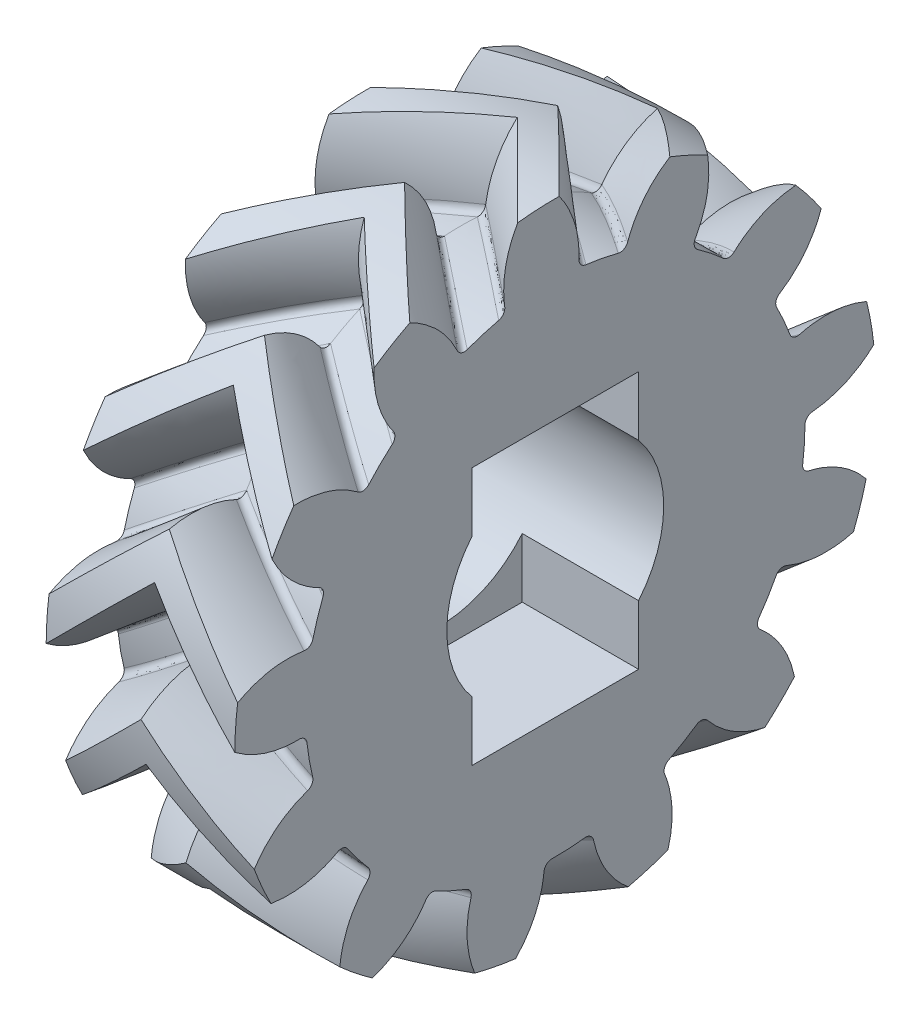
from build123d import *

# Parameters (mm, degrees)
BASPROSKE_W            = 3
BASPROSKE_H            = 10.192388155
TOOTHCUTRH_PITCH       = 64.040663503
TOOTHCUTRH_HEIGHT      = 3
TOOTHCUTRH_RADIUS      = 10.192388155
TOOTHCUTRH_START_ANGLE = -90
TEETHCUTSRH_COUNT      = 13
TEETHCUTSRH_ANGLE      = 332.307692308
BORSKE_R               = 2.4
BORE_DEPTH             = 62.5000025
SKETCH_1_R             = 3.45
CUT_EXTRUDE_1_DEPTH    = 16.613121341
SKETCH_3_W             = 5.3
SKETCH_3_H             = 8.2
CUT_EXTRUDE_2_DEPTH    = 3.7


with BuildPart() as part:
    # BasProSke → Base-Revolve (revolve)
    with BuildSketch(Plane(origin=(0, 0, 0), x_dir=(1, 0, 0), z_dir=(0, 1, 0)), mode=Mode.PRIVATE) as base_revolve_sk:
        with Locations((1.5, 5.096194078)):
            Rectangle(BASPROSKE_W, BASPROSKE_H)
    revolve(base_revolve_sk.sketch.rotate(Axis((-10, 0, 0), (1, 0, 0)), 180), axis=Axis((-10, 0, 0), (1, 0, 0)))

    # ToothCutRH: sweep along a helix
    with BuildLine() as toothcutrh_path:
        add(Helix(TOOTHCUTRH_PITCH, TOOTHCUTRH_HEIGHT, TOOTHCUTRH_RADIUS, center=(0, 0, 0), direction=(1, 0, 0), mode=Mode.PRIVATE).rotate(Axis((0, 0, 0), (1, 0, 0)), TOOTHCUTRH_START_ANGLE))
    # TooCutSkeRH → ToothCutRH (sweep, cut)
    with BuildSketch(Plane(origin=(0, 0, 0), x_dir=(0, 0, -1), z_dir=(1, 0, 0))):
        with BuildLine():
            ThreePointArc((0.523123318, 7.92514174), (0, 7.942388155), (-0.523123318, 7.92514174))
            ThreePointArc((-0.523123318, 7.92514174), (-0.696914518, 7.979968083), (-0.787810721, 8.137914875))
            ThreePointArc((-0.787810721, 8.137914875), (-1.227460211, 9.34413994), (-2.099915116, 10.285996096))
            ThreePointArc((-2.099915116, 10.285996096), (0, 10.4981598), (2.099915116, 10.285996096))
            ThreePointArc((2.099915116, 10.285996096), (1.227460211, 9.34413994), (0.787810721, 8.137914875))
            ThreePointArc((0.787810721, 8.137914875), (0.696914518, 7.979968083), (0.523123318, 7.92514174))
        make_face()
    toothcutrh = sweep(path=toothcutrh_path.line, is_frenet=True, mode=Mode.SUBTRACT)

    # TeethCutsRH: ToothCutRH ×13 about axis
    teethcutsrh_axis = Axis((-10, 0, 0), (1, 0, 0))
    for i in range(1, TEETHCUTSRH_COUNT):
        add(toothcutrh.rotate(teethcutsrh_axis, i * TEETHCUTSRH_ANGLE / (TEETHCUTSRH_COUNT - 1)), mode=Mode.SUBTRACT)

    # BorSke → Bore (cut, symmetric)
    with BuildSketch(Plane(origin=(0, 0, 0), x_dir=(0, 0, -1), z_dir=(1, 0, 0))):
        with Locations(Location((0, 0, 0), (0, 0, 180))):
            Circle(BORSKE_R)
    extrude(amount=BORE_DEPTH, both=True, mode=Mode.SUBTRACT)

    # 鏡射1: part across plane


with BuildPart() as part_1:
    add(part.part)
    add(part.part.mirror(Plane(origin=(0, 0, 0), x_dir=(0, 0, 1), z_dir=(1, 0, 0))))

    # 草圖1 → 除料-伸長1 (cut, through all)
    with BuildSketch(Plane(origin=(3, 0, 0), x_dir=(0, 0, -1), z_dir=(1, 0, 0))):
        Circle(SKETCH_1_R)
    extrude(amount=-CUT_EXTRUDE_1_DEPTH, mode=Mode.SUBTRACT)

    # 草圖3 → 除料-伸長2 (cut)
    with BuildSketch(Plane(origin=(3, 0, 0), x_dir=(0, 0, -1), z_dir=(1, 0, 0))):
        Rectangle(SKETCH_3_W, SKETCH_3_H)
    extrude(amount=-CUT_EXTRUDE_2_DEPTH, mode=Mode.SUBTRACT)


solid = part_1.part
